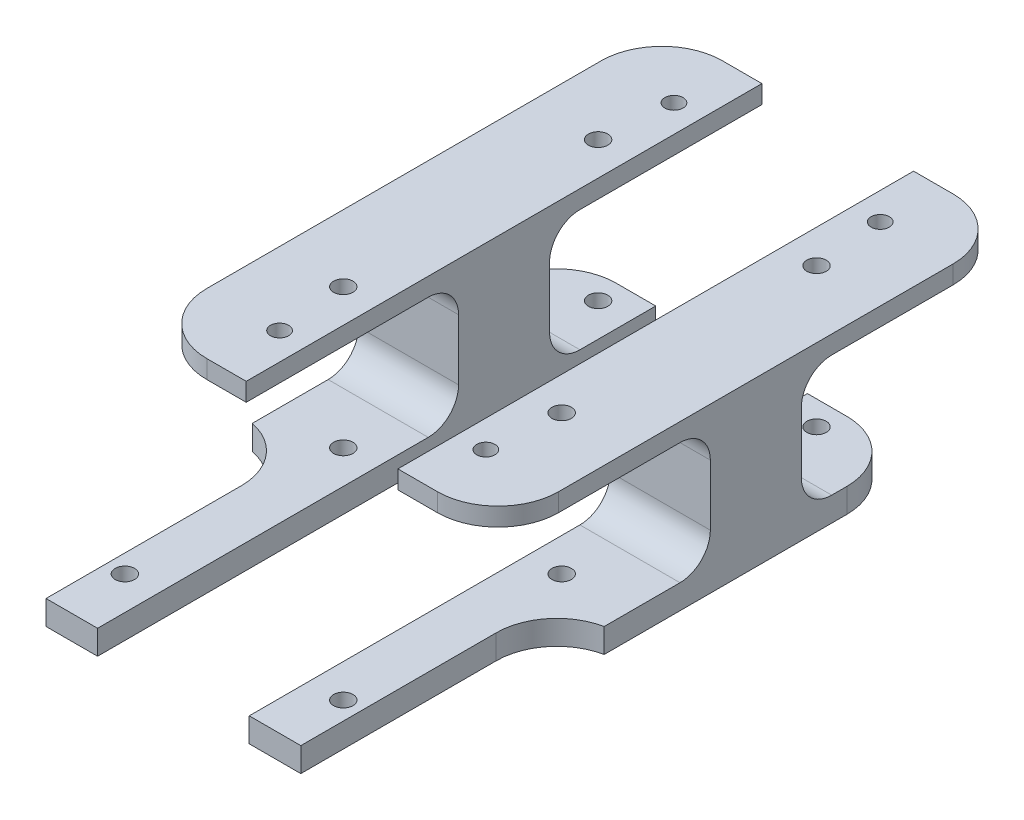
from build123d import *

# Parameters (mm, degrees)
SKETCH_1_R          = 1.5
EXTRUDE_1_DEPTH     = 3
SKETCH_4_W          = 58
SKETCH_4_H          = 15
EXTRUDE_2_DEPTH     = 20
SKETCH_5_R          = 1.6
EXTRUDE_3_DEPTH     = 4
FILLET_1_R          = 10
CUT_EXTRUDE_START   = -63
SKETCH_6_R          = 1.6
CUT_EXTRUDE_2_DEPTH = 63
SKETCH_7_W          = 25
SKETCH_7_H          = 85
CUT_EXTRUDE_3_DEPTH = 63
SKETCH_8_W          = 25
SKETCH_8_H          = 24.5
CUT_EXTRUDE_4_DEPTH = 63
FILLET_2_R          = 5
FILLET_3_R          = 5
FILLET_4_R          = 5


with BuildPart() as part:
    # 草图1 → 凸台-拉伸1 (new body)
    with BuildSketch(Plane(origin=(0, 0, 0), x_dir=(1, 0, 0), z_dir=(0, 1, 0))):
        with BuildLine():
            Line((-29, -42.5), (29, -42.5))
            Line((29, -42.5), (29, 32.5))
            ThreePointArc((29, 32.5), (26.071067812, 39.571067812), (19, 42.5))
            Line((19, 42.5), (-19, 42.5))
            ThreePointArc((-19, 42.5), (-26.071067812, 39.571067812), (-29, 32.5))
            Line((-29, 32.5), (-29, -42.5))
        make_face()
        with Locations(Location((17, 32.5, 0), (0, 0, 270))):
            Circle(SKETCH_1_R, mode=Mode.SUBTRACT)
        with Locations(Location((-17, 32.5, 0), (0, 0, 270))):
            Circle(SKETCH_1_R, mode=Mode.SUBTRACT)
        with Locations(Location((-17, -32.5, 0), (0, 0, 270))):
            Circle(SKETCH_1_R, mode=Mode.SUBTRACT)
        with Locations(Location((17, -32.5, 0), (0, 0, 270))):
            Circle(SKETCH_1_R, mode=Mode.SUBTRACT)
    extrude(amount=EXTRUDE_1_DEPTH)

    # 草图4 → 凸台-拉伸2 (add)
    with BuildSketch(Plane.XZ):
        Rectangle(SKETCH_4_W, SKETCH_4_H)
    extrude(amount=EXTRUDE_2_DEPTH)

    # 草图5 → 凸台-拉伸3 (add)
    with BuildSketch(Plane.XZ.offset(20)):
        Polygon((21, 25), (21, 67), (-21, 67), (-21, 25), (-29, 25), (-29, -25), (29, -25), (29, 25), align=None)
        with Locations(Location((-18, -21, 0), (0, 0, 270))):
            Circle(SKETCH_5_R, mode=Mode.SUBTRACT)
        with Locations(Location((-18, 21, 0), (0, 0, 270))):
            Circle(SKETCH_5_R, mode=Mode.SUBTRACT)
        with Locations(Location((18, 21, 0), (0, 0, 270))):
            Circle(SKETCH_5_R, mode=Mode.SUBTRACT)
        with Locations(Location((18, -21, 0), (0, 0, 270))):
            Circle(SKETCH_5_R, mode=Mode.SUBTRACT)
        with Locations(Location((-18, 57, 0), (0, 0, 270))):
            Circle(SKETCH_5_R, mode=Mode.SUBTRACT)
        with Locations(Location((18, 57, 0), (0, 0, 270))):
            Circle(SKETCH_5_R, mode=Mode.SUBTRACT)
    extrude(amount=EXTRUDE_3_DEPTH)

    # 圆角1
    # the kernel refuses this fillet: 10 mm, written as the material it adds along each edge
    with BuildSketch(Plane(origin=(-21, -20, 25), x_dir=(0, 0, 1), z_dir=(0, -1, 0))) as fillet_1_piece_1:
        with BuildLine():
            CenterArc((9.797958971, 10), FILLET_1_R, 191.536959033, 78.463040967)
            Line((0, 8), (0, 0))
            Line((0, 0), (9.797958971, 0))
        make_face()
    extrude(amount=4)
    with BuildSketch(Plane(origin=(21, -20, 25), x_dir=(0, 0, 1), z_dir=(0, -1, 0))) as fillet_1_piece_2:
        with BuildLine():
            CenterArc((9.797958971, -10), FILLET_1_R, 90, 78.463040967)
            Line((0, -8), (0, 0))
            Line((0, 0), (9.797958971, 0))
        make_face()
    extrude(amount=4)
    # the kernel refuses this fillet: 10 mm, written as the material it takes off along each edge
    with BuildSketch(Plane(origin=(29, 0, 42.5), x_dir=(0, 0, -1), z_dir=(0, 1, 0))) as fillet_1_2_piece_1:
        with BuildLine():
            CenterArc((FILLET_1_R, FILLET_1_R), FILLET_1_R, 180, 90)
            Line((0, FILLET_1_R), (0, 0))
            Line((0, 0), (FILLET_1_R, 0))
        make_face()
    extrude(amount=28, mode=Mode.SUBTRACT)
    with BuildSketch(Plane(origin=(-29, 0, 42.5), x_dir=(0, 0, -1), z_dir=(0, 1, 0))) as fillet_1_2_piece_2:
        with BuildLine():
            CenterArc((FILLET_1_R, -FILLET_1_R), FILLET_1_R, 90, 90)
            Line((0, -FILLET_1_R), (0, 0))
            Line((0, 0), (FILLET_1_R, 0))
        make_face()
    extrude(amount=28, mode=Mode.SUBTRACT)
    with BuildSketch(Plane(origin=(-29, -20, -25), x_dir=(0, 0, 1), z_dir=(0, -1, 0))) as fillet_1_2_piece_3:
        with BuildLine():
            CenterArc((FILLET_1_R, -FILLET_1_R), FILLET_1_R, 90, 90)
            Line((0, -FILLET_1_R), (0, 0))
            Line((0, 0), (FILLET_1_R, 0))
        make_face()
    extrude(amount=29, mode=Mode.SUBTRACT)
    with BuildSketch(Plane(origin=(29, -20, -25), x_dir=(0, 0, 1), z_dir=(0, -1, 0))) as fillet_1_2_piece_4:
        with BuildLine():
            CenterArc((FILLET_1_R, FILLET_1_R), FILLET_1_R, 180, 90)
            Line((0, FILLET_1_R), (0, 0))
            Line((0, 0), (FILLET_1_R, 0))
        make_face()
    extrude(amount=29, mode=Mode.SUBTRACT)

    # 草图6 → 切除-拉伸2 (cut)
    with BuildSketch(Plane.XZ.offset(24).offset(CUT_EXTRUDE_START)):
        with Locations(Location((18, 21, 0), (0, 0, 270))):
            Circle(SKETCH_6_R)
        with Locations(Location((18, -21, 0), (0, 0, 270))):
            Circle(SKETCH_6_R)
        with Locations(Location((-18, -21, 0), (0, 0, 270))):
            Circle(SKETCH_6_R)
        with Locations(Location((-18, 21, 0), (0, 0, 270))):
            Circle(SKETCH_6_R)
    extrude(amount=CUT_EXTRUDE_2_DEPTH, mode=Mode.SUBTRACT)

    # 草图7 → 切除-拉伸3 (cut)
    with BuildSketch(Plane(origin=(0, 3, 0), x_dir=(1, 0, 0), z_dir=(0, 1, 0))):
        Rectangle(SKETCH_7_W, SKETCH_7_H)
    extrude(amount=-CUT_EXTRUDE_3_DEPTH, mode=Mode.SUBTRACT)

    # 草图8 → 切除-拉伸4 (cut)
    with BuildSketch(Plane(origin=(0, -20, 0), x_dir=(1, 0, 0), z_dir=(0, 1, 0))):
        with Locations((0, -54.75)):
            Rectangle(SKETCH_8_W, SKETCH_8_H)
    extrude(amount=-CUT_EXTRUDE_4_DEPTH, mode=Mode.SUBTRACT)


with BuildPart() as cut_extrude_4_piece_1:
    # of the separate pieces the step leaves, piece 1, a body of its own (cut_extrude_4_pieces)
    add(part.part.solids().sort_by_distance((-12.5, -20, 67))[0])

    # 圆角2
    fillet_2_edges = [cut_extrude_4_piece_1.edges().sort_by_distance(p)[0] for p in [
        (-20.75, 0, 7.5),
        (-20.75, 0, -7.5),
    ]]
    fillet(fillet_2_edges, radius=FILLET_2_R)

    # 圆角4
    fillet_4_edges = [cut_extrude_4_piece_1.edges().sort_by_distance(p)[0] for p in [
        (-20.75, -20, 7.5),
        (-20.75, -20, -7.5),
    ]]
    fillet(fillet_4_edges, radius=FILLET_4_R)


with BuildPart() as cut_extrude_4_piece_2:
    # of the separate pieces the step leaves, piece 2, a body of its own (cut_extrude_4_pieces)
    add(part.part.solids().sort_by_distance((21, -20, 34.797958971))[0])

    # 圆角3
    fillet_3_edges = [cut_extrude_4_piece_2.edges().sort_by_distance(p)[0] for p in [
        (20.75, 0, 7.5),
        (20.75, 0, -7.5),
        (20.75, -20, -7.5),
        (20.75, -20, 7.5),
    ]]
    fillet(fillet_3_edges, radius=FILLET_3_R)


solid = Compound([cut_extrude_4_piece_1.part, cut_extrude_4_piece_2.part])
